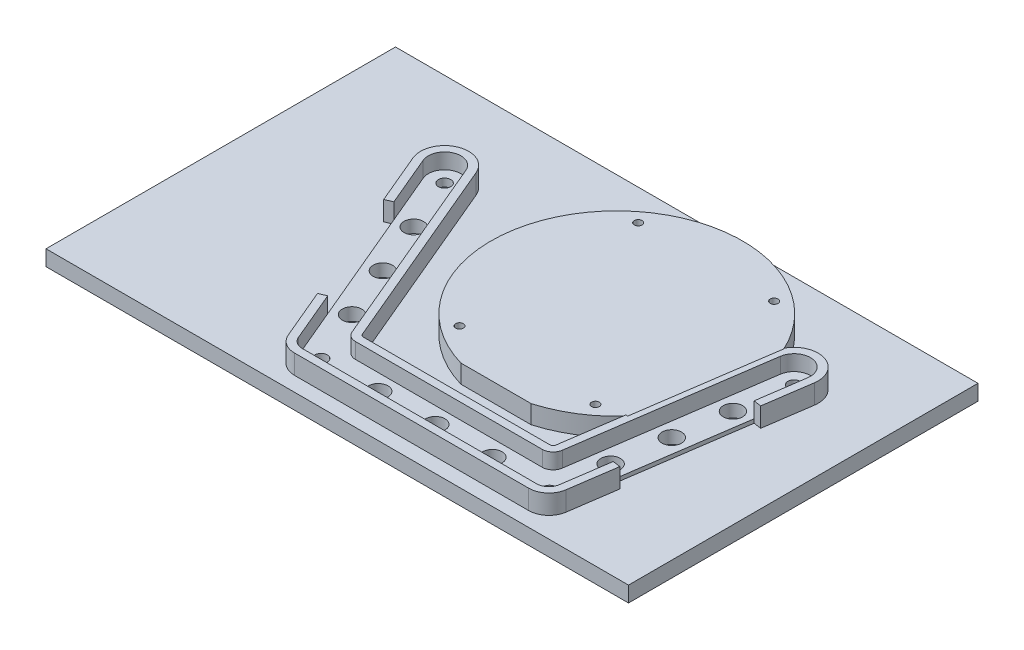
from build123d import *

# Parameters (mm, degrees)
SKETCH1_W           = 150
SKETCH1_H           = 90
BOSS_EXTRUDE1_DEPTH = 4
BOSS_EXTRUDE3_START = 4
BOSS_EXTRUDE3_DEPTH = 1
SKETCH3_R           = 1.6
CUT_EXTRUDE3_DEPTH  = 2
SKETCH5_R           = 2.5
CUT_EXTRUDE4_DEPTH  = 3.25
BOSS_EXTRUDE2_DEPTH = 5
CUT_EXTRUDE5_REACH  = 89.926
SKETCH10_R          = 1
BOSS_EXTRUDE4_DEPTH = 4.7244
CUT_EXTRUDE6_DEPTH  = 0.2756


# Read off the part's stored shape, not the designer's step: Boss-Extrude3
with BuildPart() as part:
    # Sketch1 → Boss-Extrude1 (new body)
    with BuildSketch(Plane(origin=(0, 0, 0), x_dir=(1, 0, 0), z_dir=(0, 1, 0))):
        Rectangle(SKETCH1_W, SKETCH1_H)
    extrude(amount=BOSS_EXTRUDE1_DEPTH)

    # Boss-Extrude3 outline → Boss-Extrude3 (add)
    with BuildSketch(Plane(origin=(0, 0, 0), x_dir=(1, 0, 0), z_dir=(0, 1, 0)).offset(BOSS_EXTRUDE3_START)):
        with BuildLine():
            ThreePointArc((-33.446001745, 21.59344723), (-38.948165427, 23.830899981), (-41.185618178, 18.328736299))
            Line((-41.185618178, 18.328736299), (-17.72774219, -37.282607638))
            ThreePointArc((-17.72774219, -37.282607638), (-16.548520363, -38.70535138), (-14.779316882, -39.238908236))
            Line((-14.779316882, -39.238908236), (45.549258637, -39.238908236))
            ThreePointArc((45.549258637, -39.238908236), (47.642826881, -38.459026417), (48.715935243, -36.499515742))
            Line((48.715935243, -36.499515742), (56.840453083, 19.356544412))
            ThreePointArc((56.840453083, 19.356544412), (53.28873739, 24.117354809), (48.527926993, 20.565639116))
            Line((48.527926993, 20.565639116), (41.399551878, -28.441939804))
            ThreePointArc((41.399551878, -28.441939804), (40.460582061, -30.156511644), (38.628709848, -30.838908236))
            Line((38.628709848, -30.838908236), (-9.471261516, -30.838908236))
            ThreePointArc((-9.471261516, -30.838908236), (-11.019314561, -30.372045987), (-12.05113366, -29.127145213))
            Line((-12.05113366, -29.127145213), (-33.446001745, 21.59344723))
        make_face()
    extrude(amount=BOSS_EXTRUDE3_DEPTH)

    # Sketch3 → Cut-Extrude3 (cut)
    with BuildSketch(Plane(origin=(0, 5, 0), x_dir=(1, 0, 0), z_dir=(0, 1, 0))):
        with Locations(Location((-37.315809962, 19.961091764, 0), (0, 0, 270))):
            Circle(SKETCH3_R)
        with Locations(Location((-14.115809962, -35.038908236, 0), (0, 0, 270))):
            Circle(SKETCH3_R)
        with Locations(Location((44.684190038, -35.038908236, 0), (0, 0, 270))):
            Circle(SKETCH3_R)
        with Locations(Location((52.684190038, 19.961091764, 0), (0, 0, 270))):
            Circle(SKETCH3_R)
    extrude(amount=-CUT_EXTRUDE3_DEPTH, mode=Mode.SUBTRACT)

    # Sketch5 → Cut-Extrude4 (cut)
    with BuildSketch(Plane(origin=(0, 5, 0), x_dir=(1, 0, 0), z_dir=(0, 1, 0))):
        with Locations(Location((-31.515809962, 6.211091764, 0), (0, 0, 270))):
            Circle(SKETCH5_R)
        with Locations(Location((15.284190038, -35.038908236, 0), (0, 0, 270))):
            Circle(SKETCH5_R)
        with Locations(Location((46.684190038, -21.288908236, 0), (0, 0, 270))):
            Circle(SKETCH5_R)
        with Locations(Location((-19.915809962, -21.288908236, 0), (0, 0, 270))):
            Circle(SKETCH5_R)
        with Locations(Location((50.684190038, 6.211091764, 0), (0, 0, 270))):
            Circle(SKETCH5_R)
        with Locations(Location((-25.715809962, -7.538908236, 0), (0, 0, 270))):
            Circle(SKETCH5_R)
        with Locations(Location((0.584190038, -35.038908236, 0), (0, 0, 270))):
            Circle(SKETCH5_R)
        with Locations(Location((29.984190038, -35.038908236, 0), (0, 0, 270))):
            Circle(SKETCH5_R)
        with Locations(Location((48.684190038, -7.538908236, 0), (0, 0, 270))):
            Circle(SKETCH5_R)
    extrude(amount=-CUT_EXTRUDE4_DEPTH, mode=Mode.SUBTRACT)

    # Sketch6 → Boss-Extrude2 (add)
    with BuildSketch(Plane(origin=(0, 4, 0), x_dir=(1, 0, 0), z_dir=(0, 1, 0))):
        with BuildLine():
            Line((46.548754115, 20.853518808), (39.420378999, -28.154060112))
            ThreePointArc((39.420378999, -28.154060112), (39.152101909, -28.643937781), (38.628709848, -28.838908236))
            Line((38.628709848, -28.838908236), (-9.471261516, -28.838908236))
            ThreePointArc((-9.471261516, -28.838908236), (-9.913562386, -28.705519022), (-10.208367842, -28.349833086))
            Line((-10.208367842, -28.349833086), (-31.603235928, 22.370759357))
            ThreePointArc((-31.603235928, 22.370759357), (-39.725477554, 25.673665798), (-43.028383996, 17.551424172))
            Line((-43.028383996, 17.551424172), (-19.570508008, -38.059919765))
            ThreePointArc((-19.570508008, -38.059919765), (-17.654272538, -40.371878346), (-14.779316882, -41.238908236))
            Line((-14.779316882, -41.238908236), (45.549258637, -41.238908236))
            ThreePointArc((45.549258637, -41.238908236), (48.951307033, -39.97160028), (50.695108121, -36.787395433))
            Line((50.695108121, -36.787395433), (58.819625962, 19.068664721))
            ThreePointArc((58.819625962, 19.068664721), (53.576617082, 26.096527688), (46.548754115, 20.853518808))
        make_face()
        with BuildLine():
            Line((-9.471261516, -30.838908236), (38.628709848, -30.838908236))
            ThreePointArc((38.628709848, -30.838908236), (40.460582061, -30.156511644), (41.399551878, -28.441939804))
            Line((41.399551878, -28.441939804), (48.527926993, 20.565639116))
            ThreePointArc((48.527926993, 20.565639116), (53.28873739, 24.117354809), (56.840453083, 19.356544412))
            Line((56.840453083, 19.356544412), (48.715935243, -36.499515742))
            ThreePointArc((48.715935243, -36.499515742), (47.642826881, -38.459026417), (45.549258637, -39.238908236))
            Line((45.549258637, -39.238908236), (-14.779316882, -39.238908236))
            ThreePointArc((-14.779316882, -39.238908236), (-16.548520363, -38.70535138), (-17.72774219, -37.282607638))
            Line((-17.72774219, -37.282607638), (-41.185618178, 18.328736299))
            ThreePointArc((-41.185618178, 18.328736299), (-38.948165427, 23.830899981), (-33.446001745, 21.59344723))
            Line((-33.446001745, 21.59344723), (-12.05113366, -29.127145213))
            ThreePointArc((-12.05113366, -29.127145213), (-11.019314561, -30.372045987), (-9.471261516, -30.838908236))
        make_face(mode=Mode.SUBTRACT)
    extrude(amount=BOSS_EXTRUDE2_DEPTH)

    # Cut-Extrude5: up to this face of the body (flat: up to its plane)
    cut_extrude5_end = Plane(part.part.faces().sort_by_distance((-2.356631327, 4, -3.006871304))[0])
    # Sketch9 → Cut-Extrude5 (cut, up to the picked face)
    with BuildSketch(Plane(origin=(0, 9, 0), x_dir=(1, 0, 0), z_dir=(0, 1, 0)), mode=Mode.PRIVATE) as cut_extrude5_sk1:
        Polygon((-23.238183171, -24.219062209), (-35.675177197, 5.26519087), (-37.517943015, 4.487878743), (-25.080948989, -24.996374336), align=None)
    cut_extrude5_tool1 = split(extrude(cut_extrude5_sk1.sketch, amount=-CUT_EXTRUDE5_REACH, mode=Mode.PRIVATE), bisect_by=cut_extrude5_end, keep=Keep.BOTH, mode=Mode.PRIVATE)
    # Sketch9 → Cut-Extrude5 (cut, up to the picked face)
    with BuildSketch(Plane(origin=(0, 9, 0), x_dir=(1, 0, 0), z_dir=(0, 1, 0)), mode=Mode.PRIVATE) as cut_extrude5_sk2:
        Polygon((55.081231695, 7.261897364), (50.475156632, -24.404868693), (52.45432951, -24.692748385), (57.060404573, 6.974017672), align=None)
    cut_extrude5_tool2 = split(extrude(cut_extrude5_sk2.sketch, amount=-CUT_EXTRUDE5_REACH, mode=Mode.PRIVATE), bisect_by=cut_extrude5_end, keep=Keep.BOTH, mode=Mode.PRIVATE)
    add(cut_extrude5_tool1.solids().sort_by(Axis((-30.378063, 9, 9.865592), (0, -1, 0)))[0], mode=Mode.SUBTRACT)
    add(cut_extrude5_tool2.solids().sort_by(Axis((53.767781, 9, 8.715426), (0, -1, 0)))[0], mode=Mode.SUBTRACT)

    # Sketch10 → Boss-Extrude4 (add)
    with BuildSketch(Plane(origin=(0, 4, 0), x_dir=(1, 0, 0), z_dir=(0, 1, 0))):
        with BuildLine():
            Line((8.603375751, -21.785908236), (26.725004326, -21.785908236))
            ThreePointArc((26.725004326, -21.785908236), (34.872763222, -18.130879321), (41.713269692, -12.390436602))
            Line((41.713269692, -12.390436602), (46.548754115, 20.853518808))
            ThreePointArc((46.548754115, 20.853518808), (46.771885392, 21.8278145), (47.148675016, 22.753594842))
            ThreePointArc((47.148675016, 22.753594842), (-6.835267399, 30.523629914), (8.603375751, -21.785908236))
        make_face()
        with Locations(Location((0.164190038, 32.321352082, 0), (0, 0, 270))):
            Circle(SKETCH10_R, mode=Mode.SUBTRACT)
        with Locations(Location((0.164190038, -13.678647918, 0), (0, 0, 270))):
            Circle(SKETCH10_R, mode=Mode.SUBTRACT)
        with Locations(Location((35.164190038, -13.678647918, 0), (0, 0, 270))):
            Circle(SKETCH10_R, mode=Mode.SUBTRACT)
        with Locations(Location((35.164190038, 32.321352082, 0), (0, 0, 270))):
            Circle(SKETCH10_R, mode=Mode.SUBTRACT)
    extrude(amount=BOSS_EXTRUDE4_DEPTH)

    # Sketch11 → Cut-Extrude6 (cut)
    with BuildSketch(Plane(origin=(0, 9, 0), x_dir=(1, 0, 0), z_dir=(0, 1, 0))):
        Polygon((41.713269692, -12.390436602), (46.831832261, 22.799681061), (47.32662548, 22.727711139), (42.208062911, -12.462406525), align=None)
    extrude(amount=-CUT_EXTRUDE6_DEPTH, mode=Mode.SUBTRACT)


solid = part.part
